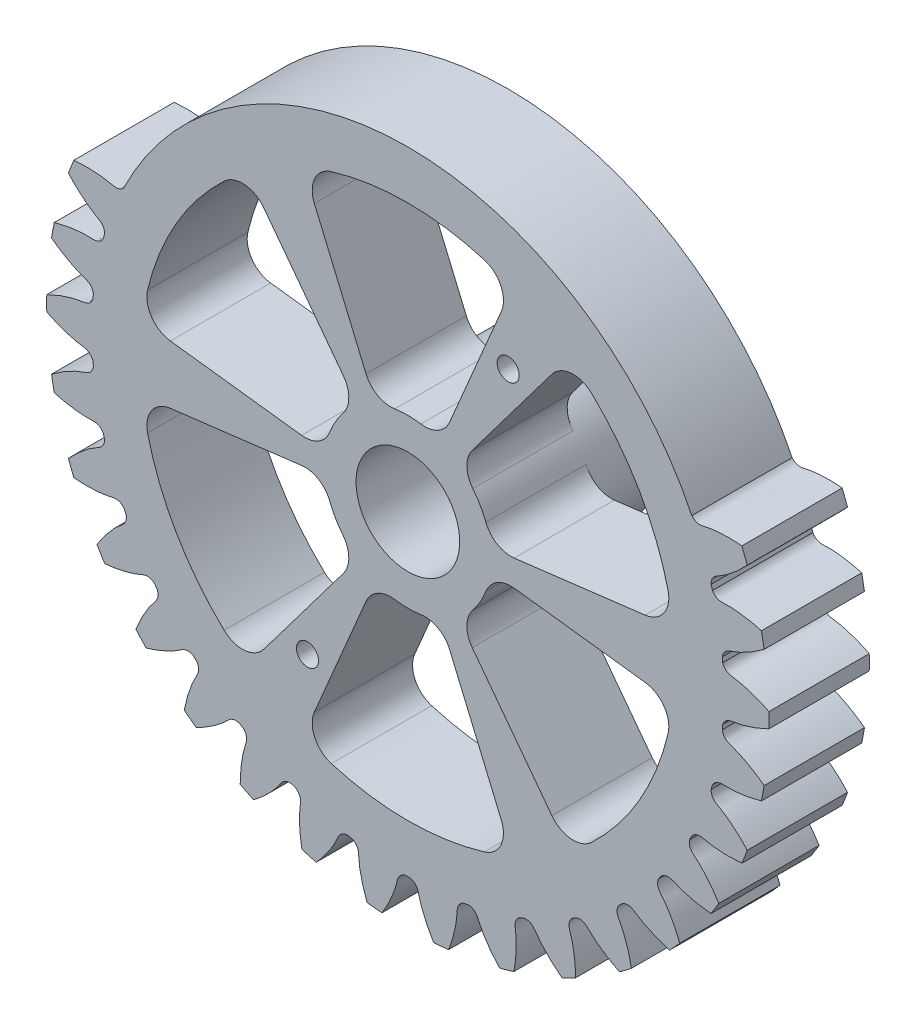
from build123d import *
from build123d.topology import SkipClean

# Parameters (mm, degrees)
SKETCH_1_R               = 54
EXTRUDE_1_DEPTH          = 15
CUT_EXTRUDE_1_DEPTH      = 78.826730626
PATTERN_CIRCULAR_1_COUNT = 34
SKETCH_4_R               = 7.75
CUT_EXTRUDE_2_DEPTH      = 78.730704607
SKETCH_5_R               = 1.65
CUT_EXTRUDE_3_DEPTH      = 78.730704607
EXTRUDE_START            = 10
SKETCH_6_R               = 12.5
SKETCH_6_R_2             = 7.75
EXTRUDE_2_DEPTH          = 10
SKETCH_7_R               = 1.65
CUT_EXTRUDE_4_DEPTH      = 25
CUT_EXTRUDE_5_DEPTH      = 81.262458825


with BuildPart() as part:
    # 草图1 → 凸台-拉伸1 (new body)
    with BuildSketch(Plane.XY):
        Circle(SKETCH_1_R)
    extrude(amount=EXTRUDE_1_DEPTH)

    # 草图2 → 切除-拉伸1 (cut, through all)
    with BuildSketch(Plane.XY):
        with BuildLine():
            ThreePointArc((0.36634235, 47.248579802), (0, 47.25), (-0.36634235, 47.248579802))
            add(Edge.make_bspline(
                [(-0.36634235, 47.248579802), (-1.433175611, 47.550225792), (-1.52682079, 48.37757463), (-1.759892712, 49.247259793), (-1.825860717, 49.476491643), (-1.902168488, 49.722628665), (-1.989386581, 49.985399955), (-2.088247309, 50.264442826), (-2.199422253, 50.559394681), (-2.323587984, 50.869865886), (-2.461405851, 51.195448151), (-2.613527227, 51.535712419), (-2.780591263, 51.890209854), (-2.963224851, 52.258471942), (-3.162041951, 52.64001087), (-3.37764311, 53.034319839), (-3.610614943, 53.440873414), (-3.861529626, 53.859127878), (-4.130944407, 54.288521606), (-4.419401113, 54.728475443), (-4.72742568, 55.178393101), (-5.055527683, 55.637661567), (-5.404199876, 56.105651516), (-5.773917753, 56.581717748), (-6.165139106, 57.065199625), (-6.578303598, 57.555421523), (-7.013832358, 58.051693297), (-7.472127559, 58.553310756), (-7.95357208, 59.059556141), (-8.458528935, 59.569698629), (-9.172783229, 60.262995143), (-9.731183617, 60.773001621), (-10.114726691, 61.109833085)],
                knots=[0, 0, 0, 0, 0.13072362, 0.143503881, 0.157401081, 0.17241522, 0.188546299, 0.205794316, 0.224159273, 0.243641169, 0.264240005, 0.285955779, 0.308788493, 0.332738146, 0.357804738, 0.383988269, 0.411288739, 0.439706149, 0.469240498, 0.499891786, 0.531660014, 0.56454518, 0.598547286, 0.633666331, 0.669902315, 0.707255238, 0.745725101, 0.785311903, 0.826015644, 0.867836324, 0.910773943, 1, 1, 1, 1], degree=3))
            ThreePointArc((-10.114726691, 61.109833085), (0, 61.941257621), (10.114726691, 61.109833085))
            add(Edge.make_bspline(
                [(0.36634235, 47.248579802), (1.433175611, 47.550225792), (1.52682079, 48.37757463), (1.759892712, 49.247259793), (1.825860717, 49.476491643), (1.902168488, 49.722628665), (1.989386581, 49.985399955), (2.088247309, 50.264442826), (2.199422253, 50.559394681), (2.323587984, 50.869865886), (2.461405851, 51.195448151), (2.613527227, 51.535712419), (2.780591263, 51.890209854), (2.963224851, 52.258471942), (3.162041951, 52.64001087), (3.37764311, 53.034319839), (3.610614943, 53.440873414), (3.861529626, 53.859127878), (4.130944407, 54.288521606), (4.419401113, 54.728475443), (4.72742568, 55.178393101), (5.055527683, 55.637661567), (5.404199876, 56.105651516), (5.773917753, 56.581717748), (6.165139106, 57.065199625), (6.578303598, 57.555421523), (7.013832358, 58.051693297), (7.472127559, 58.553310756), (7.95357208, 59.059556141), (8.458528935, 59.569698629), (9.172783229, 60.262995143), (9.731183617, 60.773001621), (10.114726691, 61.109833085)],
                knots=[0, 0, 0, 0, 0.13072362, 0.143503881, 0.157401081, 0.17241522, 0.188546299, 0.205794316, 0.224159273, 0.243641169, 0.264240005, 0.285955779, 0.308788493, 0.332738146, 0.357804738, 0.383988269, 0.411288739, 0.439706149, 0.469240498, 0.499891786, 0.531660014, 0.56454518, 0.598547286, 0.633666331, 0.669902315, 0.707255238, 0.745725101, 0.785311903, 0.826015644, 0.867836324, 0.910773943, 1, 1, 1, 1], degree=3))
        make_face()
    cut_extrude_1 = extrude(amount=CUT_EXTRUDE_1_DEPTH, mode=Mode.SUBTRACT)

    # 阵列(圆周)1: 切除-拉伸1 ×34 about axis
    pattern_circular_1_axis = Axis((0, 0, -0.75), (0, 0, 1))
    for i in range(1, PATTERN_CIRCULAR_1_COUNT):
        add(cut_extrude_1.rotate(pattern_circular_1_axis, i * 360 / PATTERN_CIRCULAR_1_COUNT), mode=Mode.SUBTRACT)

    # 草图4 → 切除-拉伸2 (cut, through all)
    with BuildSketch(Plane(origin=(0, 0, 0), x_dir=(-1, 0, 0), z_dir=(0, 0, -1))):
        Circle(SKETCH_4_R)
        with BuildLine():
            Line((-13.979221828, 32.932982815), (-6.254749898, 14.735267345))
            ThreePointArc((-6.254749898, 14.735267345), (-4.512874584, 12.800215176), (-1.949038246, 12.347115044))
            ThreePointArc((-1.949038246, 12.347115044), (0, 12.5), (1.949038246, 12.347115044))
            ThreePointArc((1.949038246, 12.347115044), (4.512874584, 12.800215176), (6.254749898, 14.735267345))
            Line((6.254749898, 14.735267345), (13.979221828, 32.932982815))
            ThreePointArc((13.979221828, 32.932982815), (13.916817175, 36.198372888), (11.441336015, 38.328785921))
            ThreePointArc((11.441336015, 38.328785921), (0, 40), (-11.441336015, 38.328785921))
            ThreePointArc((-11.441336015, 38.328785921), (-13.916817175, 36.198372888), (-13.979221828, 32.932982815))
        make_face()
        with BuildLine():
            Line((21.531188826, 28.572852635), (9.633740903, 12.784405978))
            ThreePointArc((9.633740903, 12.784405978), (8.828874224, 10.308371622), (9.718396169, 7.861474156))
            ThreePointArc((9.718396169, 7.861474156), (10.825317547, 6.25), (11.667434415, 4.485640889))
            ThreePointArc((11.667434415, 4.485640889), (13.341748809, 2.491843554), (15.888490801, 1.950861366))
            Line((15.888490801, 1.950861366), (35.510410654, 4.36013018))
            ThreePointArc((35.510410654, 4.36013018), (38.307119084, 6.04686923), (38.914370312, 9.255905318))
            ThreePointArc((38.914370312, 9.255905318), (34.641016151, 20), (27.473034296, 29.072880603))
            ThreePointArc((27.473034296, 29.072880603), (24.390301909, 30.151503657), (21.531188826, 28.572852635))
        make_face()
        with BuildLine():
            Line((35.510410654, -4.36013018), (15.888490801, -1.950861366))
            ThreePointArc((15.888490801, -1.950861366), (13.341748809, -2.491843554), (11.667434415, -4.485640889))
            ThreePointArc((11.667434415, -4.485640889), (10.825317547, -6.25), (9.718396169, -7.861474156))
            ThreePointArc((9.718396169, -7.861474156), (8.828874224, -10.308371622), (9.633740903, -12.784405978))
            Line((9.633740903, -12.784405978), (21.531188826, -28.572852635))
            ThreePointArc((21.531188826, -28.572852635), (24.390301909, -30.151503657), (27.473034296, -29.072880603))
            ThreePointArc((27.473034296, -29.072880603), (34.641016151, -20), (38.914370312, -9.255905318))
            ThreePointArc((38.914370312, -9.255905318), (38.307119084, -6.04686923), (35.510410654, -4.36013018))
        make_face()
        with BuildLine():
            Line((13.979221828, -32.932982815), (6.254749898, -14.735267345))
            ThreePointArc((6.254749898, -14.735267345), (4.512874584, -12.800215176), (1.949038246, -12.347115044))
            ThreePointArc((1.949038246, -12.347115044), (0, -12.5), (-1.949038246, -12.347115044))
            ThreePointArc((-1.949038246, -12.347115044), (-4.512874584, -12.800215176), (-6.254749898, -14.735267345))
            Line((-6.254749898, -14.735267345), (-13.979221828, -32.932982815))
            ThreePointArc((-13.979221828, -32.932982815), (-13.916817175, -36.198372888), (-11.441336015, -38.328785921))
            ThreePointArc((-11.441336015, -38.328785921), (0, -40), (11.441336015, -38.328785921))
            ThreePointArc((11.441336015, -38.328785921), (13.916817175, -36.198372888), (13.979221828, -32.932982815))
        make_face()
        with BuildLine():
            Line((-21.531188826, -28.572852635), (-9.633740903, -12.784405978))
            ThreePointArc((-9.633740903, -12.784405978), (-8.828874224, -10.308371622), (-9.718396169, -7.861474156))
            ThreePointArc((-9.718396169, -7.861474156), (-10.825317547, -6.25), (-11.667434415, -4.485640889))
            ThreePointArc((-11.667434415, -4.485640889), (-13.341748809, -2.491843554), (-15.888490801, -1.950861366))
            Line((-15.888490801, -1.950861366), (-35.510410654, -4.36013018))
            ThreePointArc((-35.510410654, -4.36013018), (-38.307119084, -6.04686923), (-38.914370312, -9.255905318))
            ThreePointArc((-38.914370312, -9.255905318), (-34.641016151, -20), (-27.473034296, -29.072880603))
            ThreePointArc((-27.473034296, -29.072880603), (-24.390301909, -30.151503657), (-21.531188826, -28.572852635))
        make_face()
        with BuildLine():
            Line((-35.510410654, 4.36013018), (-15.888490801, 1.950861366))
            ThreePointArc((-15.888490801, 1.950861366), (-13.341748809, 2.491843554), (-11.667434415, 4.485640889))
            ThreePointArc((-11.667434415, 4.485640889), (-10.825317547, 6.25), (-9.718396169, 7.861474156))
            ThreePointArc((-9.718396169, 7.861474156), (-8.828874224, 10.308371622), (-9.633740903, 12.784405978))
            Line((-9.633740903, 12.784405978), (-21.531188826, 28.572852635))
            ThreePointArc((-21.531188826, 28.572852635), (-24.390301909, 30.151503657), (-27.473034296, 29.072880603))
            ThreePointArc((-27.473034296, 29.072880603), (-34.641016151, 20), (-38.914370312, 9.255905318))
            ThreePointArc((-38.914370312, 9.255905318), (-38.307119084, 6.04686923), (-35.510410654, 4.36013018))
        make_face()
    extrude(amount=-CUT_EXTRUDE_2_DEPTH, mode=Mode.SUBTRACT)

    # 草图5 → 切除-拉伸3 (cut, through all)
    with BuildSketch(Plane(origin=(0, 0, 0), x_dir=(-1, 0, 0), z_dir=(0, 0, -1))):
        with Locations((-15, 25.980762114)):
            Circle(SKETCH_5_R)
        with Locations((15, -25.980762114)):
            Circle(SKETCH_5_R)
    extrude(amount=-CUT_EXTRUDE_3_DEPTH, mode=Mode.SUBTRACT)

    # 草图6 → 凸台-拉伸2 (add)
    with SkipClean():  # the faces are left unmerged after this step: merging them gives an invalid solid
        with BuildSketch(Plane(origin=(0, 0, 0), x_dir=(-1, 0, 0), z_dir=(0, 0, -1)).offset(EXTRUDE_START)):
            Circle(SKETCH_6_R)
            Circle(SKETCH_6_R_2, mode=Mode.SUBTRACT)
        extrude(amount=-EXTRUDE_2_DEPTH)

    # 草图7 → 切除-拉伸4 (cut, symmetric)
    with SkipClean():  # the faces are left unmerged after this step: merging them gives an invalid solid
        with BuildSketch(Plane(origin=(0, 0, 0), x_dir=(1, 0, 0), z_dir=(0, 1, 0))):
            with Locations((0, 5)):
                Circle(SKETCH_7_R)
        extrude(amount=CUT_EXTRUDE_4_DEPTH, both=True, mode=Mode.SUBTRACT)

    # 草图8 → 切除-拉伸5 (cut, through all)
    with SkipClean():  # the faces are left unmerged after this step: merging them gives an invalid solid
        with BuildSketch(Plane.XY.offset(15)):
            with BuildLine():
                Line((-48.113490854, 24.517177608), (-42.13190137, 21.388440497))
                ThreePointArc((-42.13190137, 21.388440497), (0.36634235, 47.248579802), (42.458487044, 20.73256805))
                Line((42.458487044, 20.73256805), (48.13198037, 24.480859169))
                ThreePointArc((48.13198037, 24.480859169), (0.020377017, 53.999996155), (-48.113490854, 24.517177608))
            make_face()
        extrude(amount=-CUT_EXTRUDE_5_DEPTH, mode=Mode.SUBTRACT)


solid = part.part
